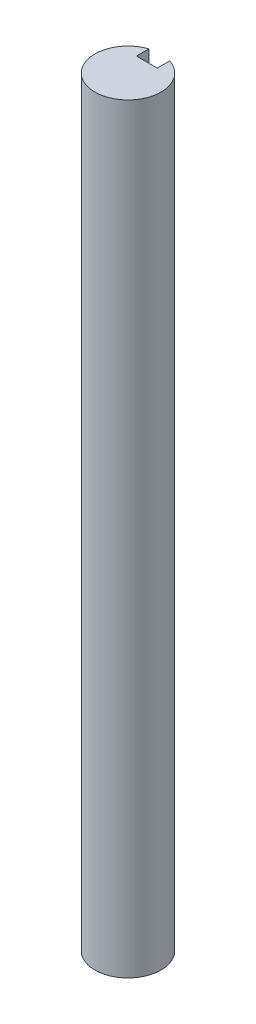
from build123d import *

# Parameters (mm, degrees)
BOSS_EXTRUDE1_DEPTH = 73.025


with BuildPart() as part:
    # Sketch1 → Boss-Extrude1 (new body)
    with BuildSketch(Plane(origin=(0, 0, 0), x_dir=(1, 0, 0), z_dir=(0, 1, 0))):
        with BuildLine():
            Line((-1, 3.01340754), (-1, 1.81340754))
            Line((-1, 1.81340754), (1, 1.81340754))
            Line((1, 1.81340754), (1, 3.01340754))
            ThreePointArc((1, 3.01340754), (0, -3.175), (-1, 3.01340754))
        make_face()
    extrude(amount=BOSS_EXTRUDE1_DEPTH)


solid = part.part
